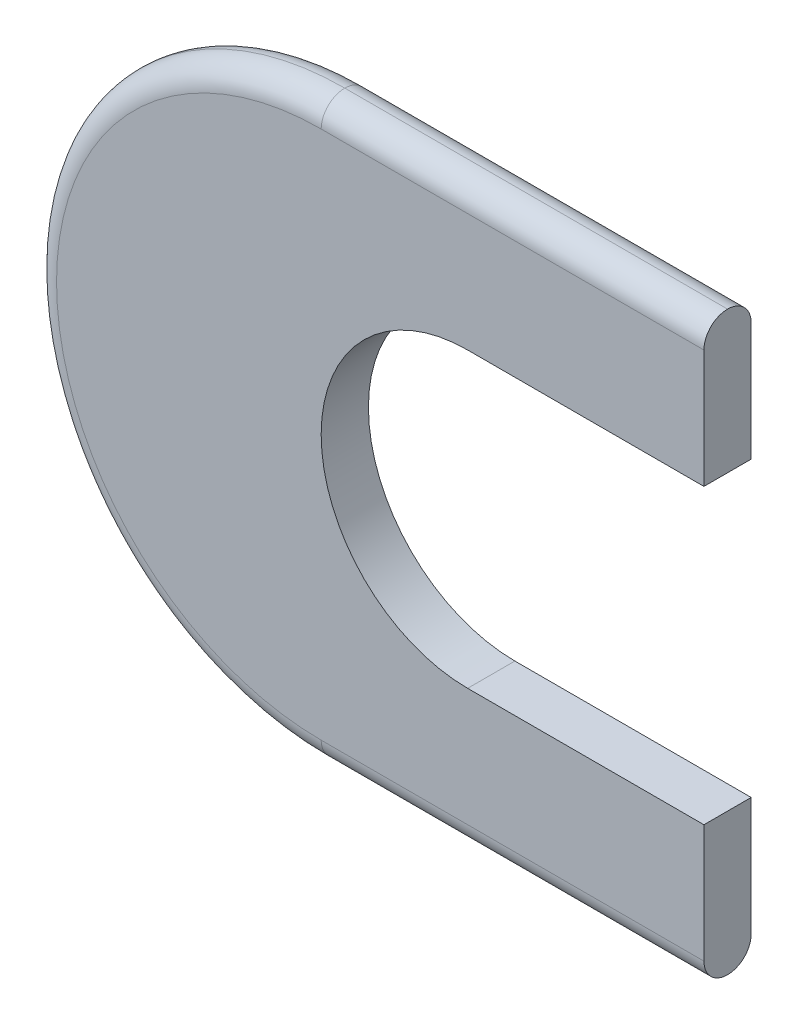
from build123d import *

# Parameters (mm, degrees)
BOSS_EXTRUDE1_DEPTH = 1
FILLET1_R           = 0.5


with BuildPart() as part:
    # Sketch1 → Boss-Extrude1 (new body)
    with BuildSketch(Plane.XY):
        with BuildLine():
            Line((0, 3.1), (5, 3.1))
            Line((5, 3.1), (5, 6.1))
            Line((5, 6.1), (-3.1, 6.1))
            ThreePointArc((-3.1, 6.1), (-9.2, 0), (-3.1, -6.1))
            Line((-3.1, -6.1), (5, -6.1))
            Line((5, -6.1), (5, -3.1))
            Line((5, -3.1), (0, -3.1))
            ThreePointArc((0, -3.1), (-3.1, 0), (0, 3.1))
        make_face()
    extrude(amount=BOSS_EXTRUDE1_DEPTH)

    # Fillet1
    fillet1_edges = [part.edges().sort_by_distance(p)[0] for p in [
        (0.95, 6.1, 0),
        (0.95, -6.1, 0),
        (0.95, 6.1, 1),
        (0.95, -6.1, 1),
        (-9.2, 0, 0),
        (-9.2, 0, 1),
    ]]
    fillet(fillet1_edges, radius=FILLET1_R - 0.0001)  # a hair under: the kernel refuses the full size


solid = part.part
